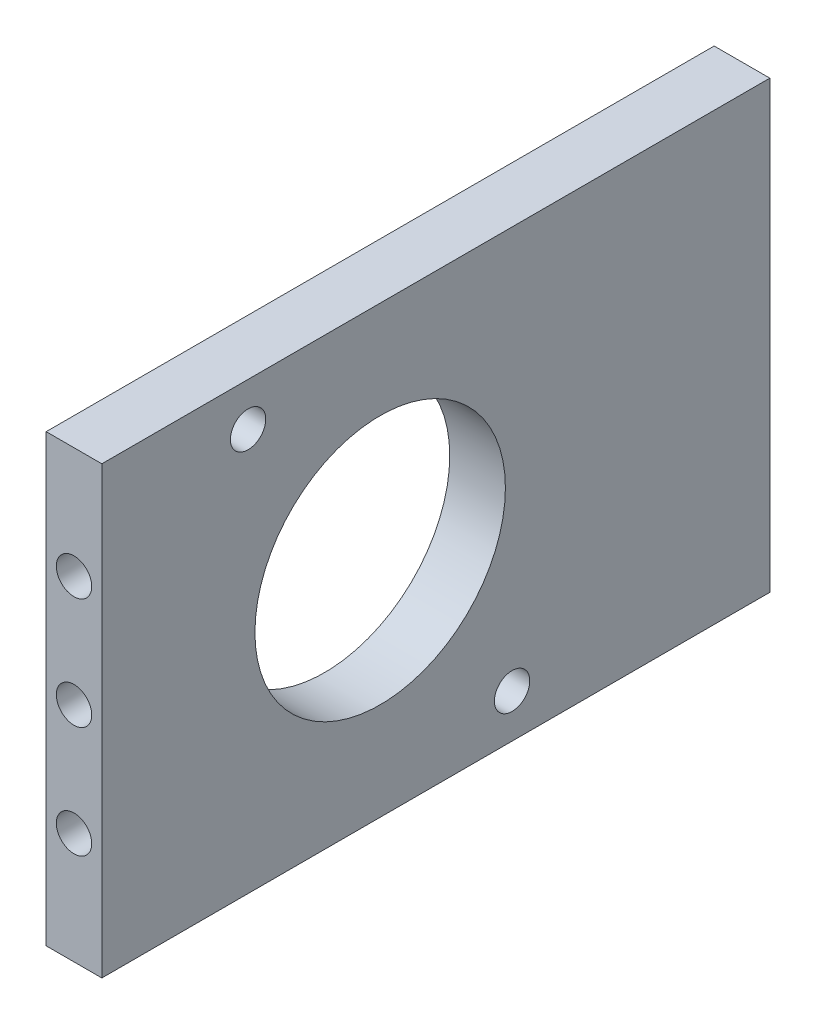
from build123d import *

# Parameters (mm, degrees)
SKETCH2_W                  = 76.2
SKETCH2_H                  = 50.8
BOSS_EXTRUDE2_DEPTH        = 6.35
F_10_32_TAPPED_HOLE1_D     = 4.0386
F_10_32_TAPPED_HOLE1_DEPTH = 12.02944
F_10_32_TAPPED_HOLE1_TIP   = 1.213317848
SKETCH6_R                  = 14.2875
CUT_EXTRUDE1_DEPTH         = 47.228697797
F_10_32_TAPPED_HOLE2_D     = 4.0386
F_10_32_TAPPED_HOLE2_DEPTH = 12.02944
F_10_32_TAPPED_HOLE2_TIP   = 1.213317848


with BuildPart() as part:
    # Sketch2 → Boss-Extrude2 (new body)
    with BuildSketch(Plane(origin=(0, 0, 0), x_dir=(0, 0, -1), z_dir=(1, 0, 0))):
        Rectangle(SKETCH2_W, SKETCH2_H)
    extrude(amount=BOSS_EXTRUDE2_DEPTH)

    # #10-32 Tapped Hole1
    with Locations(Plane.XY.offset(38.1)):
        with Locations((3.175, -12.7), (3.175, 0), (3.175, 12.7)):
            Hole(F_10_32_TAPPED_HOLE1_D / 2, depth=F_10_32_TAPPED_HOLE1_DEPTH)
            with Locations((0, 0, -(F_10_32_TAPPED_HOLE1_DEPTH + F_10_32_TAPPED_HOLE1_TIP / 2))):  # 118° drill point
                Cone(0, F_10_32_TAPPED_HOLE1_D / 2, F_10_32_TAPPED_HOLE1_TIP, mode=Mode.SUBTRACT)

    # Sketch6 → Cut-Extrude1 (cut, through all)
    with BuildSketch(Plane(origin=(6.35, 0, 0), x_dir=(0, 0, -1), z_dir=(1, 0, 0))):
        with Locations((-6.35, 0)):
            Circle(SKETCH6_R)
    extrude(amount=-CUT_EXTRUDE1_DEPTH, mode=Mode.SUBTRACT)

    # #10-32 Tapped Hole2
    with Locations(Plane.ZY):
        with Locations((-8.697751527, -20.444937619), (21.419512309, 20.464601843)):
            Hole(F_10_32_TAPPED_HOLE2_D / 2, depth=F_10_32_TAPPED_HOLE2_DEPTH)
            with Locations((0, 0, -(F_10_32_TAPPED_HOLE2_DEPTH + F_10_32_TAPPED_HOLE2_TIP / 2))):  # 118° drill point
                Cone(0, F_10_32_TAPPED_HOLE2_D / 2, F_10_32_TAPPED_HOLE2_TIP, mode=Mode.SUBTRACT)


solid = part.part
